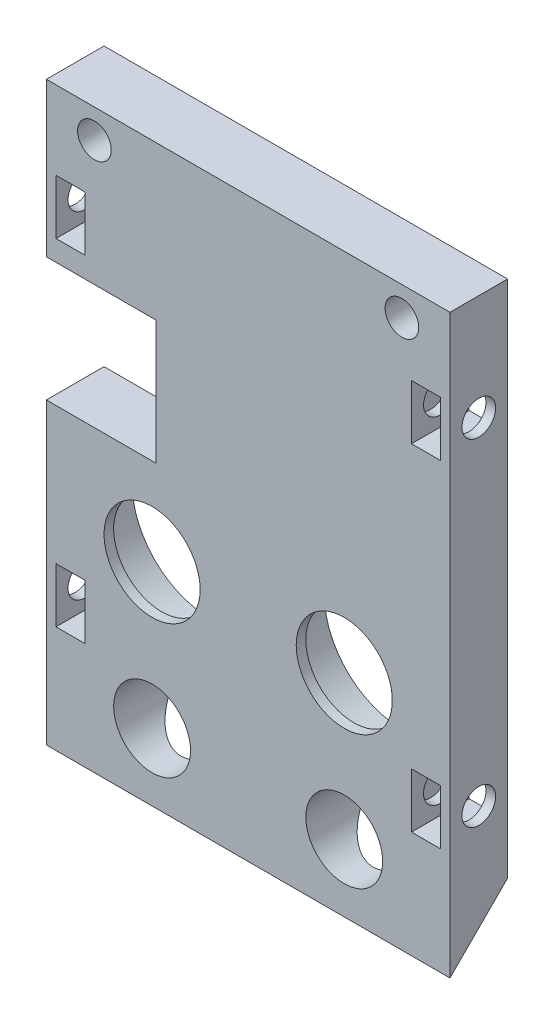
from build123d import *

# Parameters (mm, degrees)
SKETCH1_R           = 4
SKETCH1_R_2         = 5
SKETCH1_R_3         = 1.75
BOSS_EXTRUDE1_DEPTH = 6
CHAMFER1_SIZE       = 6
CUT_EXTRUDE2_DEPTH  = 10
SKETCH4_W           = 3
SKETCH4_H           = 5.7
CUT_EXTRUDE3_DEPTH  = 38.107950631
CUT_EXTRUDE4_START  = -6
SKETCH2_R           = 8.075
CUT_EXTRUDE4_DEPTH  = 5
SKETCH5_R           = 1.75
CUT_EXTRUDE5_DEPTH  = 5


with BuildPart() as part:
    # Sketch1 → Boss-Extrude1 (new body)
    with BuildSketch(Plane.XY):
        Polygon((-21, -30), (21, -30), (21, 30), (-21, 30), (-21, -8), align=None)
        with Locations((-10, -23)):
            Circle(SKETCH1_R, mode=Mode.SUBTRACT)
        with Locations((-10, -8)):
            Circle(SKETCH1_R_2, mode=Mode.SUBTRACT)
        with Locations(Location((10, -8, 0), (0, 0, 180))):
            Circle(SKETCH1_R_2, mode=Mode.SUBTRACT)
        with Locations(Location((10, -23, 0), (0, 0, 180))):
            Circle(SKETCH1_R, mode=Mode.SUBTRACT)
        with Locations((16, 27)):
            Circle(SKETCH1_R_3, mode=Mode.SUBTRACT)
        with Locations(Location((-16, 27, 0), (0, 0, 180))):
            Circle(SKETCH1_R_3, mode=Mode.SUBTRACT)
    extrude(amount=BOSS_EXTRUDE1_DEPTH)

    # Chamfer1
    # the kernel refuses this chamfer: 6 mm, written as the material it takes off along each edge
    with BuildSketch(Plane(origin=(-36.430097928, -30, 0), x_dir=(0, -0.027495876610586202, 0.9996219169112968), z_dir=(1, 0, 0))) as chamfer1_piece_1:
        Polygon((CHAMFER1_SIZE * 0.999621916911, -CHAMFER1_SIZE * 0.0274958766106), (-CHAMFER1_SIZE * 0.0274958766106, -CHAMFER1_SIZE * 0.999621916911), (0, 0), align=None)
    extrude(amount=72.860195856, mode=Mode.SUBTRACT)

    # Sketch3 → Cut-Extrude2 (cut)
    with BuildSketch(Plane(origin=(0, 0, 0), x_dir=(-1, 0, 0), z_dir=(0, 0, -1))):
        Polygon((9.6, 14), (9.611608629, 1.1), (21, 1.1), (21, 14), align=None)
    extrude(amount=-CUT_EXTRUDE2_DEPTH, mode=Mode.SUBTRACT)

    # Sketch4 → Cut-Extrude3 (cut, through all)
    with BuildSketch(Plane(origin=(0, 0, 0), x_dir=(-1, 0, 0), z_dir=(0, 0, -1))):
        with Locations((-18.5, -16)):
            Rectangle(SKETCH4_W, SKETCH4_H)
        with Locations((18.5, -16)):
            Rectangle(SKETCH4_W, SKETCH4_H)
        with Locations((-18.5, 19)):
            Rectangle(SKETCH4_W, SKETCH4_H)
        with Locations((18.5, 19)):
            Rectangle(SKETCH4_W, SKETCH4_H)
    extrude(amount=-CUT_EXTRUDE3_DEPTH, mode=Mode.SUBTRACT)

    # Sketch2 → Cut-Extrude4 (cut)
    with BuildSketch(Plane.XY.offset(6).offset(CUT_EXTRUDE4_START)):
        with Locations((-10, -8)):
            Circle(SKETCH2_R)
        with Locations(Location((10, -8, 0), (0, 0, 180))):
            Circle(SKETCH2_R)
    extrude(amount=CUT_EXTRUDE4_DEPTH, mode=Mode.SUBTRACT)

    # Sketch5 → Cut-Extrude5 (cut)
    with BuildSketch(Plane(origin=(21, 0, 0), x_dir=(0, 0, -1), z_dir=(1, 0, 0))):
        with Locations(Location((-3, -16, 0), (0, 0, 90))):
            Circle(SKETCH5_R)
        with Locations(Location((-3, 19, 0), (0, 0, 90))):
            Circle(SKETCH5_R)
    cut_extrude5 = extrude(amount=-CUT_EXTRUDE5_DEPTH, mode=Mode.SUBTRACT)

    # Mirror1: Cut-Extrude5 across plane
    add(cut_extrude5.mirror(Plane(origin=(0, 0, 0), x_dir=(0, 0, 1), z_dir=(1, 0, 0))), mode=Mode.SUBTRACT)


solid = part.part
